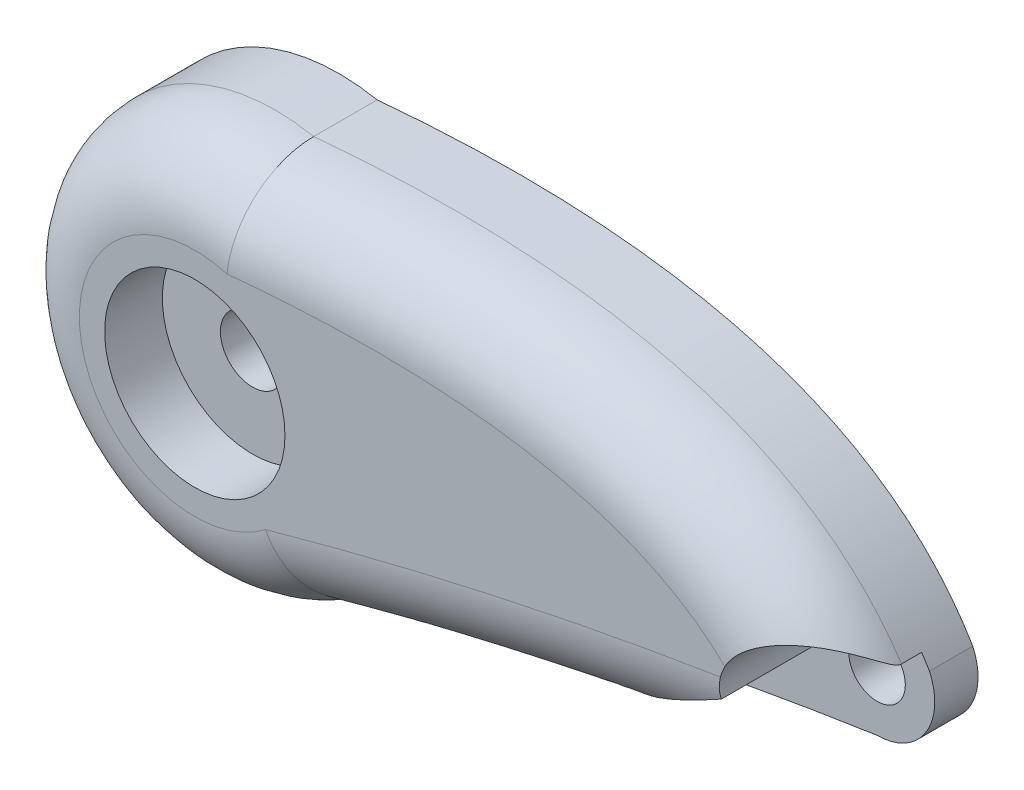
from build123d import *

# Parameters (mm, degrees)
BOSS_EXTRUDE1_OUTLINE_R   = 1.411527177
BOSS_EXTRUDE1_OUTLINE_R_2 = 1.243983369
BOSS_EXTRUDE1_DEPTH       = 8.89
CUT_EXTRUDE1_START        = -4.445
SKETCH3_R                 = 2.54
CUT_EXTRUDE1_DEPTH        = 4.445
FILLET2_R                 = 3.556
SKETCH4_W                 = 38.788702954
SKETCH4_H                 = 29.49823266
CUT_EXTRUDE2_DEPTH        = 2.54
SKETCH5_R                 = 3.96875
CUT_EXTRUDE6_DEPTH        = 2.54
CUT_EXTRUDE9_DEPTH        = 4.445
CUT_EXTRUDE10_DEPTH       = 8.89


# Read off the part's stored shape, not the designer's step: Boss-Extrude1
with BuildPart() as part:
    # Boss-Extrude1 outline → Boss-Extrude1 (new body)
    with BuildSketch(Plane.XY):
        with BuildLine():
            add(Edge.make_bspline(
                [(-4.450270059, 36.453127637), (9.257211294, 37.68062732), (17.994865779, 35.108973576), (21.762693397, 28.738166405)],
                knots=[0.06260201, 0.06260201, 0.06260201, 0.06260201, 0.571198862, 0.571198862, 0.571198862, 0.571198862], degree=3))
            ThreePointArc((-4.450270059, 36.453127637), (-14.614683226, 26.381475664), (-1.480390785, 20.703110531))
            add(Edge.make_bspline(
                [(19.455202419, 25.136523629), (8.814175151, 23.55437226), (-1.480390785, 20.703110531)],
                knots=[0, 0, 0, 0.700849117, 0.700849117, 0.700849117], degree=2))
            ThreePointArc((19.455202419, 25.136523629), (21.593913789, 26.306299678), (21.762693397, 28.738166405))
        make_face()
        with Locations((-6.128238366, 27.981709907)):
            Circle(BOSS_EXTRUDE1_OUTLINE_R, mode=Mode.SUBTRACT)
        with Locations((19.455202419, 27.676523629)):
            Circle(BOSS_EXTRUDE1_OUTLINE_R_2, mode=Mode.SUBTRACT)
    extrude(amount=BOSS_EXTRUDE1_DEPTH)

    # Sketch3 → Cut-Extrude1 (cut)
    with BuildSketch(Plane.XY.offset(8.89).offset(CUT_EXTRUDE1_START)):
        with Locations((19.455202419, 27.676523629)):
            Circle(SKETCH3_R)
    extrude(amount=CUT_EXTRUDE1_DEPTH, mode=Mode.SUBTRACT)

    # Fillet2
    fillet2_edges = [part.edges().sort_by_distance(p)[0] for p in [
        (-14.614683226, 26.381475664, 8.89),
        (8.919366654, 23.241027384, 8.89),
        (9.568834416, 36.110759147, 8.89),
    ]]
    fillet(fillet2_edges, radius=FILLET2_R)

    # Sketch4 → Cut-Extrude2 (cut)
    with BuildSketch(Plane(origin=(0, 0, 0), x_dir=(-1, 0, 0), z_dir=(0, 0, -1))):
        with Locations((-4.403454377, 29.061669641)):
            Rectangle(SKETCH4_W, SKETCH4_H)
    extrude(amount=-CUT_EXTRUDE2_DEPTH, mode=Mode.SUBTRACT)

    # Sketch5 → Cut-Extrude6 (cut)
    with BuildSketch(Plane.XY.offset(8.89)):
        with Locations((-6.128238366, 27.981709907)):
            Circle(SKETCH5_R)
    extrude(amount=-CUT_EXTRUDE6_DEPTH, mode=Mode.SUBTRACT)

    # Sketch11 → Cut-Extrude9 (cut)
    with BuildSketch(Plane.XY.offset(8.89)):
        Polygon((8.044294619, 22.027673787), (18.775840599, 28.536123817), (19.455202419, 27.676523629), (23.93696494, 27.676523629), (25.091261189, 21.861175279), (8.722262202, 18.612070842), align=None)
    extrude(amount=-CUT_EXTRUDE9_DEPTH, mode=Mode.SUBTRACT)

    # Sketch13 → Cut-Extrude10 (cut)
    with BuildSketch(Plane(origin=(0, 0, 2.54), x_dir=(-1, 0, 0), z_dir=(0, 0, -1))):
        with BuildLine():
            Line((10.206570894, 20.369371253), (8.596583203, 18.138185272))
            Line((8.596583203, 18.138185272), (1.153394416, 19.253778262))
            Line((1.153394416, 19.253778262), (1.535882515, 20.771294499))
            add(Edge.make_bspline(
                [(1.535882515, 20.771294499), (6.119525821, 19.09120268), (10.206570894, 20.369371253)],
                knots=[0, 0, 0, 0.81876004, 0.81876004, 0.81876004], degree=2))
        make_face()
    extrude(amount=-CUT_EXTRUDE10_DEPTH, mode=Mode.SUBTRACT)


solid = part.part
